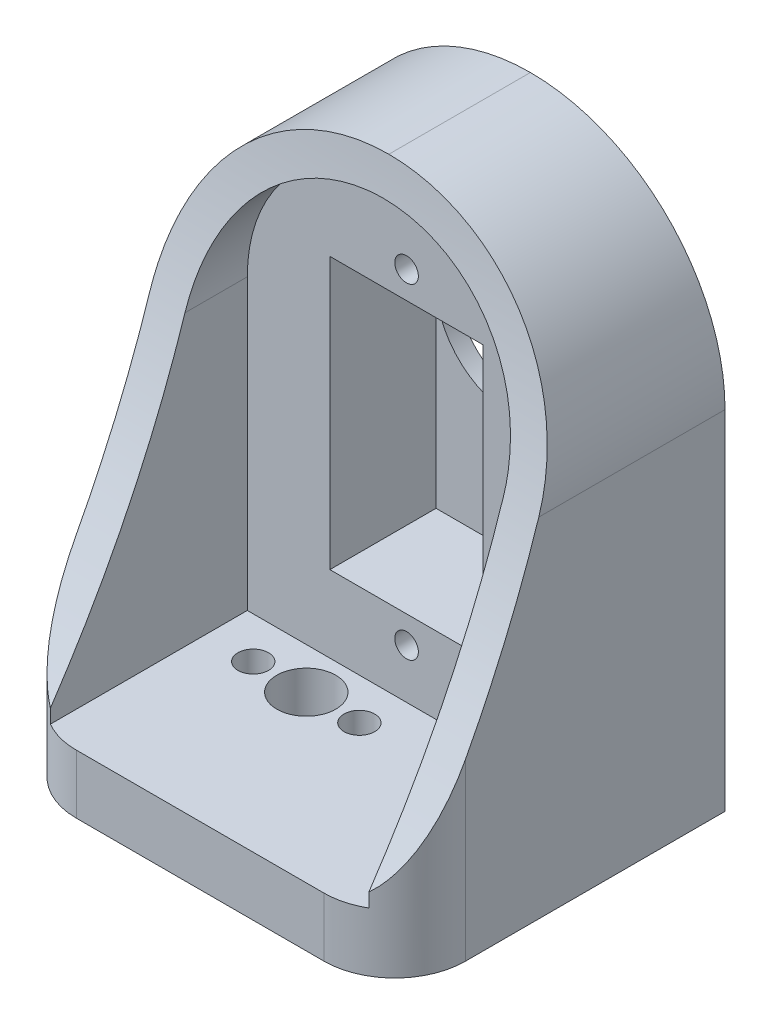
from build123d import *

# Parameters (mm, degrees)
SKETCH1_W           = 33
SKETCH1_H           = 28
BOSS_EXTRUDE1_DEPTH = 46
SKETCH2_W           = 17.5
SKETCH2_H           = 41
CUT_EXTRUDE1_DEPTH  = 59.318093247
EXTRUDE_S_DEPTH     = 3
BOSS_EXTRUDE3_DEPTH = 27
FILLET1_START       = -3.5
FILLET1_DEPTH       = 5.287760197
FILLET1_START_2     = -13.5
FILLET1_2_DEPTH     = 27
FILLET2_R           = 16.5
FILLET3_R           = 6
SKETCH5_W           = 13
SKETCH5_H           = 23
CUT_EXTRUDE3_DEPTH  = 9
SKETCH6_R           = 6.5
CUT_EXTRUDE4_DEPTH  = 9
SKETCH7_R           = 1
CUT_EXTRUDE5_DEPTH  = 8
SKETCH8_R           = 1.3
SKETCH8_R_2         = 2.5
CUT_EXTRUDE6_DEPTH  = 47.360004895


with BuildPart() as part:
    # Sketch1 → Boss-Extrude1 (new body)
    with BuildSketch(Plane(origin=(0, 0, 0), x_dir=(1, 0, 0), z_dir=(0, 1, 0))):
        Rectangle(SKETCH1_W, SKETCH1_H)
    extrude(amount=BOSS_EXTRUDE1_DEPTH)

    # Sketch2 → Cut-Extrude1 (cut, through all)
    with BuildSketch(Plane(origin=(16.5, 0, 0), x_dir=(0, 0, -1), z_dir=(1, 0, 0))):
        with Locations((-5.25, 25.5)):
            Rectangle(SKETCH2_W, SKETCH2_H)
    extrude(amount=-CUT_EXTRUDE1_DEPTH, mode=Mode.SUBTRACT)

    # Sketch3 → Extrude S (add)
    with BuildSketch(Plane(origin=(16.5, 0, 0), x_dir=(0, 0, -1), z_dir=(1, 0, 0))):
        with BuildLine():
            Line((-14, 5), (3.5, 5))
            Line((3.5, 5), (3.5, 46))
            Line((3.5, 46), (2, 46))
            add(Edge.make_bspline(
                [(2, 46), (-1.17854194, 23.414715012), (-14, 5)],
                knots=[0, 0, 0, 1, 1, 1], degree=2))
        make_face()
    extrude_s = extrude(amount=-EXTRUDE_S_DEPTH)

    # Mirror1: Extrude S across plane
    add(extrude_s.mirror(Plane(origin=(0, 0, 0), x_dir=(0, 0, 1), z_dir=(1, 0, 0))))

    # Sketch4 → Boss-Extrude3 (add)
    with BuildSketch(Plane.ZY.offset(-13.5)):
        with BuildLine():
            Line((-3.5, 46), (-3.5, 43))
            Line((-3.5, 43), (-1.532109396, 43))
            add(Edge.make_bspline(
                [(-1.532109396, 43), (-1.787586761, 44.490687359), (-1.999999999, 45.999999992)],
                knots=[0.933172744, 0.933172744, 0.933172744, 1, 1, 1], degree=2))
            Line((-1.999999999, 45.999999992), (-3.5, 46))
        make_face()
    extrude(amount=BOSS_EXTRUDE3_DEPTH)

    # Fillet1: read off the stored shape, not the designer's step
    # Fillet1 outline → Fillet1 (add)
    with BuildSketch(Plane.XY.offset(FILLET1_START)):
        with BuildLine():
            Line((-13.5, 43), (-13.5, 29.5))
            ThreePointArc((-13.5, 29.5), (-9.545941546, 39.045941546), (0, 43))
            Line((0, 43), (-13.5, 43))
        make_face()
        with BuildLine():
            Line((13.5, 43), (0, 43))
            ThreePointArc((0, 43), (9.545941546, 39.045941546), (13.5, 29.5))
            Line((13.5, 29.5), (13.5, 43))
        make_face()
    extrude(amount=FILLET1_DEPTH)

    # Fillet1 2 outline → Fillet1 2 (cut)
    with BuildSketch(Plane.YZ.offset(FILLET1_START_2)):
        with BuildLine():
            add(Edge.make_bspline(
                [(43, -1.532109396), (36.047422478, -0.340560963), (29.499999971, 1.787760107)],
                knots=[0.066827257, 0.066827257, 0.066827257, 0.378510105, 0.378510105, 0.378510105], degree=2))
            Line((43, -1.532109396), (43, 1.787760197))
            Line((43, 1.787760197), (29.499999971, 1.787760107))
        make_face()
    extrude(amount=FILLET1_2_DEPTH, mode=Mode.SUBTRACT)

    # Fillet2
    # the kernel refuses this fillet: 16.5 mm, written as the material it takes off along each edge
    with BuildSketch(Plane(origin=(16.5, 46, -55.25), x_dir=(0, -1, 0), z_dir=(0, 0, 1)), Plane(origin=(-16.5, 46, 39.25), x_dir=(0, -1, 0), z_dir=(0, 0, -1))) as fillet2_piece_1:
        with BuildLine():
            CenterArc((FILLET2_R, -FILLET2_R), FILLET2_R, 90, 90)
            Line((0, -FILLET2_R), (0, 0))
            Line((0, 0), (FILLET2_R, 0))
        make_face()
    extrude(amount=94.5, mode=Mode.SUBTRACT)

    # Fillet3
    # the kernel refuses this fillet: 6 mm, written as the material it takes off along each edge
    with BuildSketch(Plane(origin=(16.5, -15, 14), x_dir=(0, 0, -1), z_dir=(0, 1, 0)), Plane(origin=(-16.5, -15, 14), x_dir=(1, 0, 0), z_dir=(0, 1, 0))) as fillet3_piece_1:
        with BuildLine():
            CenterArc((FILLET3_R, FILLET3_R), FILLET3_R, 180, 90)
            Line((0, FILLET3_R), (0, 0))
            Line((0, 0), (FILLET3_R, 0))
        make_face()
    extrude(amount=35, mode=Mode.SUBTRACT)

    # Sketch5 → Cut-Extrude3 (cut)
    with BuildSketch(Plane.XY.offset(-3.5)):
        with Locations((0, 23)):
            Rectangle(SKETCH5_W, SKETCH5_H)
    extrude(amount=-CUT_EXTRUDE3_DEPTH, mode=Mode.SUBTRACT)

    # Sketch6 → Cut-Extrude4 (cut)
    with BuildSketch(Plane.XY.offset(-12.5)):
        with Locations((0, 28)):
            Circle(SKETCH6_R)
    extrude(amount=-CUT_EXTRUDE4_DEPTH, mode=Mode.SUBTRACT)

    # Sketch7 → Cut-Extrude5 (cut)
    with BuildSketch(Plane.XY.offset(-3.5)):
        with Locations((0, 36.8)):
            Circle(SKETCH7_R)
        with Locations((0, 9.2)):
            Circle(SKETCH7_R)
    extrude(amount=-CUT_EXTRUDE5_DEPTH, mode=Mode.SUBTRACT)

    # Sketch8 → Cut-Extrude6 (cut, through all)
    with BuildSketch(Plane(origin=(0, 5, 0), x_dir=(1, 0, 0), z_dir=(0, 1, 0))):
        with Locations(Location((-0.5, 0, 0), (0, 0, 270))):
            Circle(SKETCH8_R)
        with Locations(Location((-5, 0, 0), (0, 0, 270))):
            Circle(SKETCH8_R_2)
        with Locations(Location((-9.5, 0, 0), (0, 0, 270))):
            Circle(SKETCH8_R)
    extrude(amount=-CUT_EXTRUDE6_DEPTH, mode=Mode.SUBTRACT)


solid = part.part
